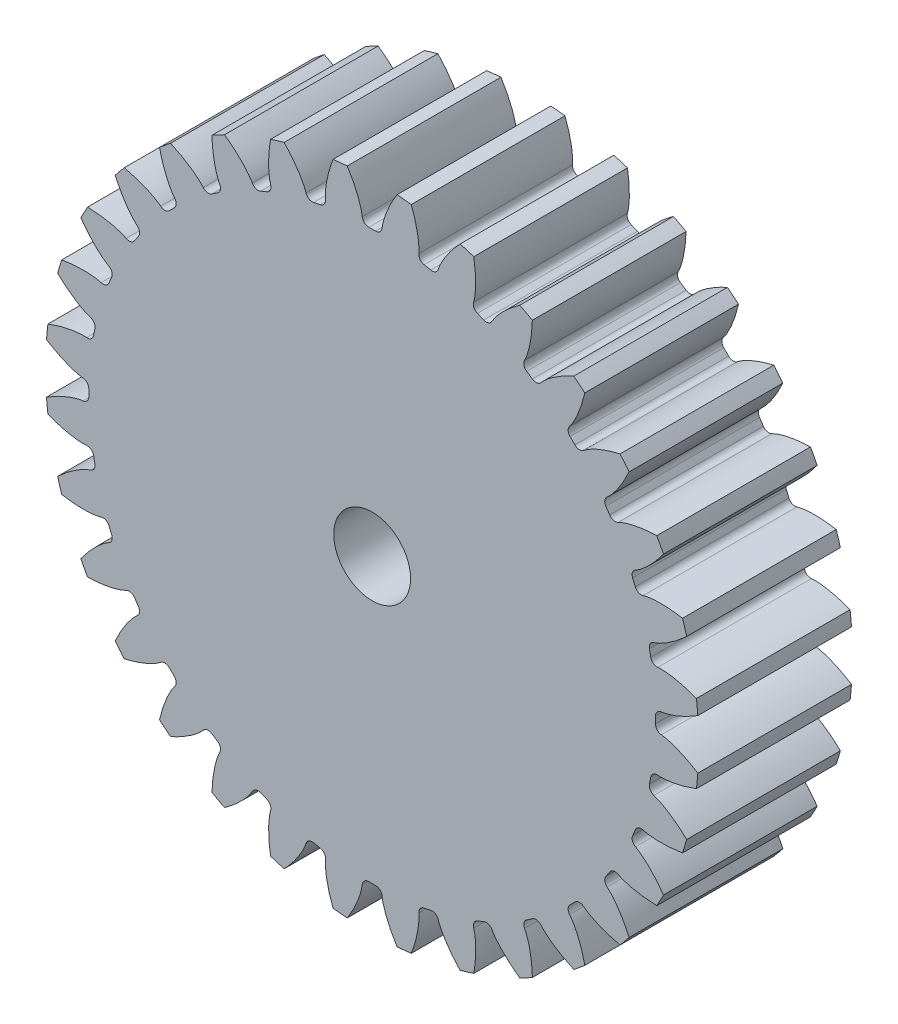
from build123d import *

# Parameters (mm, degrees)
BOSS_EXTRUDE1_DEPTH      = 6.35
BOSS_EXTRUDE1_DEPTH_BACK = 6.35
SKETCH3_R                = 26.9875
SKETCH5_W                = 12.7
SKETCH5_H                = 3.175
CUT_EXTRUDE1_DEPTH       = 39.690732902
FILLET1_R                = 0.532614244
CIRPATTERN1_COUNT        = 32
FILLET1_OF_CIRPATTERN1_R = 0.532614244


with BuildPart() as part:
    # Sketch3 → Boss-Extrude1 (new, two sides: drawn at the far end of the back side and taken through both)
    with BuildSketch(Plane.XY.offset(-BOSS_EXTRUDE1_DEPTH_BACK)):
        Circle(SKETCH3_R)
    extrude(amount=BOSS_EXTRUDE1_DEPTH + BOSS_EXTRUDE1_DEPTH_BACK)

    # Sketch5 → Cut-Revolve1 (revolve, cut)
    with BuildSketch(Plane(origin=(0, 0, 0), x_dir=(0, 0, -1), z_dir=(1, 0, 0)), mode=Mode.PRIVATE) as cut_revolve1_sk:
        with Locations((0, 1.5875)):
            Rectangle(SKETCH5_W, SKETCH5_H)
    revolve(cut_revolve1_sk.sketch.rotate(Axis((0, 0, 6.35), (0, 0, -1)), 90), axis=Axis((0, 0, 6.35), (0, 0, -1)), mode=Mode.SUBTRACT)

    # Sketch4 → Cut-Extrude1 (cut, symmetric)
    with BuildSketch(Plane.XY):
        with BuildLine():
            Line((23.401946016, 0.800260472), (23.854249202, 0.815727577))
            add(Edge.make_bspline(
                [(23.854249202, 0.815727577), (23.859158069, 0.815950328), (23.872919437, 0.816744865), (23.898907856, 0.818917415), (23.941266552, 0.823414476), (23.995160865, 0.830543629), (24.064718146, 0.841364291), (24.146513092, 0.856176304), (24.236235773, 0.874616844), (24.33365163, 0.897012094), (24.430648362, 0.921416317), (24.527217351, 0.947678656), (24.623234719, 0.97556911), (24.739314412, 1.011395303), (24.878178171, 1.057191655), (25.039974081, 1.11485008), (25.222838396, 1.185113149), (25.408478289, 1.261923386), (25.590530838, 1.341775228), (25.773713181, 1.427356908), (25.950412023, 1.513634234), (26.133117434, 1.608260748), (26.301344079, 1.698154659), (26.488847577, 1.80440237), (26.639884684, 1.891761649), (26.795061478, 1.986610286), (26.870461027, 2.033453105), (26.90894116, 2.057678759)],
                knots=[0, 0, 0, 0, 0, 0.005376749, 0.015083688, 0.02853182, 0.04661014, 0.064854849, 0.092110526, 0.119476176, 0.146842496, 0.174208854, 0.201574956, 0.228941013, 0.256307345, 0.307035032, 0.361767352, 0.416499661, 0.471231937, 0.525964282, 0.580696616, 0.635428982, 0.690161387, 0.744893688, 0.799626082, 0.854358407, 0.909090914, 0.909090914, 0.909090914, 0.909090914, 0.909090914], degree=4))
            ThreePointArc((26.90894116, 2.057678759), (26.9875, 0), (26.90894116, -2.057678759))
            add(Edge.make_bspline(
                [(23.854249202, -0.815727577), (23.859158069, -0.815950328), (23.872919437, -0.816744865), (23.898907856, -0.818917415), (23.941266552, -0.823414476), (23.995160865, -0.830543629), (24.064718146, -0.841364291), (24.146513092, -0.856176304), (24.236235773, -0.874616844), (24.33365163, -0.897012094), (24.430648362, -0.921416317), (24.527217351, -0.947678656), (24.623234719, -0.97556911), (24.739314412, -1.011395303), (24.878178171, -1.057191655), (25.039974081, -1.11485008), (25.222838396, -1.185113149), (25.408478289, -1.261923386), (25.590530838, -1.341775228), (25.773713181, -1.427356908), (25.950412023, -1.513634234), (26.133117434, -1.608260748), (26.301344079, -1.698154659), (26.488847577, -1.80440237), (26.639884684, -1.891761649), (26.795061478, -1.986610286), (26.870461027, -2.033453105), (26.90894116, -2.057678759)],
                knots=[0, 0, 0, 0, 0, 0.005376749, 0.015083688, 0.02853182, 0.04661014, 0.064854849, 0.092110526, 0.119476176, 0.146842496, 0.174208854, 0.201574956, 0.228941013, 0.256307345, 0.307035032, 0.361767352, 0.416499661, 0.471231937, 0.525964282, 0.580696616, 0.635428982, 0.690161387, 0.744893688, 0.799626082, 0.854358407, 0.909090914, 0.909090914, 0.909090914, 0.909090914, 0.909090914], degree=4))
            Line((23.854249202, -0.815727577), (23.401946016, -0.800260472))
            ThreePointArc((23.401946016, -0.800260472), (23.415625, 0), (23.401946016, 0.800260472))
        make_face()
    cut_extrude1 = extrude(amount=CUT_EXTRUDE1_DEPTH, both=True, mode=Mode.SUBTRACT)

    # Fillet1
    fillet1_edges = [part.edges().sort_by_distance(p)[0] for p in [
        (23.401946016, -0.800260472, 0),
        (23.401946016, 0.800260472, 0),
    ]]
    fillet(fillet1_edges, radius=FILLET1_R)

    # CirPattern1: Cut-Extrude1 ×32 about axis
    cirpattern1_axis = Axis((0, 0, 6.35), (0, 0, -1))
    for i in range(1, CIRPATTERN1_COUNT):
        add(cut_extrude1.rotate(cirpattern1_axis, i * 360 / CIRPATTERN1_COUNT), mode=Mode.SUBTRACT)

    # Fillet1 of CirPattern1
    fillet1_of_cirpattern1_edges = [part.edges().sort_by_distance(p)[0] for p in [
        (22.796161112, -5.350376875, 0),
        (23.108407258, -3.780609493, 0),
        (21.314332521, -9.694881296, 0),
        (21.926825369, -8.216192755, 0),
        (19.013406084, -13.666816865, 0),
        (19.902607878, -12.336032337, 0),
        (15.981805114, -17.113544327, 0),
        (17.113544327, -15.981805114, 0),
        (12.336032337, -19.902607878, 0),
        (13.666816865, -19.013406084, 0),
        (8.216192755, -21.926825369, 0),
        (9.694881296, -21.314332521, 0),
        (3.780609493, -23.108407258, 0),
        (5.350376875, -22.796161112, 0),
        (-0.800260472, -23.401946016, 0),
        (0.800260472, -23.401946016, 0),
        (-5.350376875, -22.796161112, 0),
        (-3.780609493, -23.108407258, 0),
        (-9.694881296, -21.314332521, 0),
        (-8.216192755, -21.926825369, 0),
        (-13.666816865, -19.013406084, 0),
        (-12.336032337, -19.902607878, 0),
        (-17.113544327, -15.981805114, 0),
        (-15.981805114, -17.113544327, 0),
        (-19.902607878, -12.336032337, 0),
        (-19.013406084, -13.666816865, 0),
        (-21.926825369, -8.216192755, 0),
        (-21.314332521, -9.694881296, 0),
        (-23.108407258, -3.780609493, 0),
        (-22.796161112, -5.350376875, 0),
        (-23.401946016, 0.800260472, 0),
        (-23.401946016, -0.800260472, 0),
        (-22.796161112, 5.350376875, 0),
        (-23.108407258, 3.780609493, 0),
        (-21.314332521, 9.694881296, 0),
        (-21.926825369, 8.216192755, 0),
        (-19.013406084, 13.666816865, 0),
        (-19.902607878, 12.336032337, 0),
        (-15.981805114, 17.113544327, 0),
        (-17.113544327, 15.981805114, 0),
        (-12.336032337, 19.902607878, 0),
        (-13.666816865, 19.013406084, 0),
        (-8.216192755, 21.926825369, 0),
        (-9.694881296, 21.314332521, 0),
        (-3.780609493, 23.108407258, 0),
        (-5.350376875, 22.796161112, 0),
        (0.800260472, 23.401946016, 0),
        (-0.800260472, 23.401946016, 0),
        (5.350376875, 22.796161112, 0),
        (3.780609493, 23.108407258, 0),
        (9.694881296, 21.314332521, 0),
        (8.216192755, 21.926825369, 0),
        (13.666816865, 19.013406084, 0),
        (12.336032337, 19.902607878, 0),
        (17.113544327, 15.981805114, 0),
        (15.981805114, 17.113544327, 0),
        (19.902607878, 12.336032337, 0),
        (19.013406084, 13.666816865, 0),
        (21.926825369, 8.216192755, 0),
        (21.314332521, 9.694881296, 0),
        (23.108407258, 3.780609493, 0),
        (22.796161112, 5.350376875, 0),
    ]]
    fillet(fillet1_of_cirpattern1_edges, radius=FILLET1_OF_CIRPATTERN1_R)


solid = part.part
